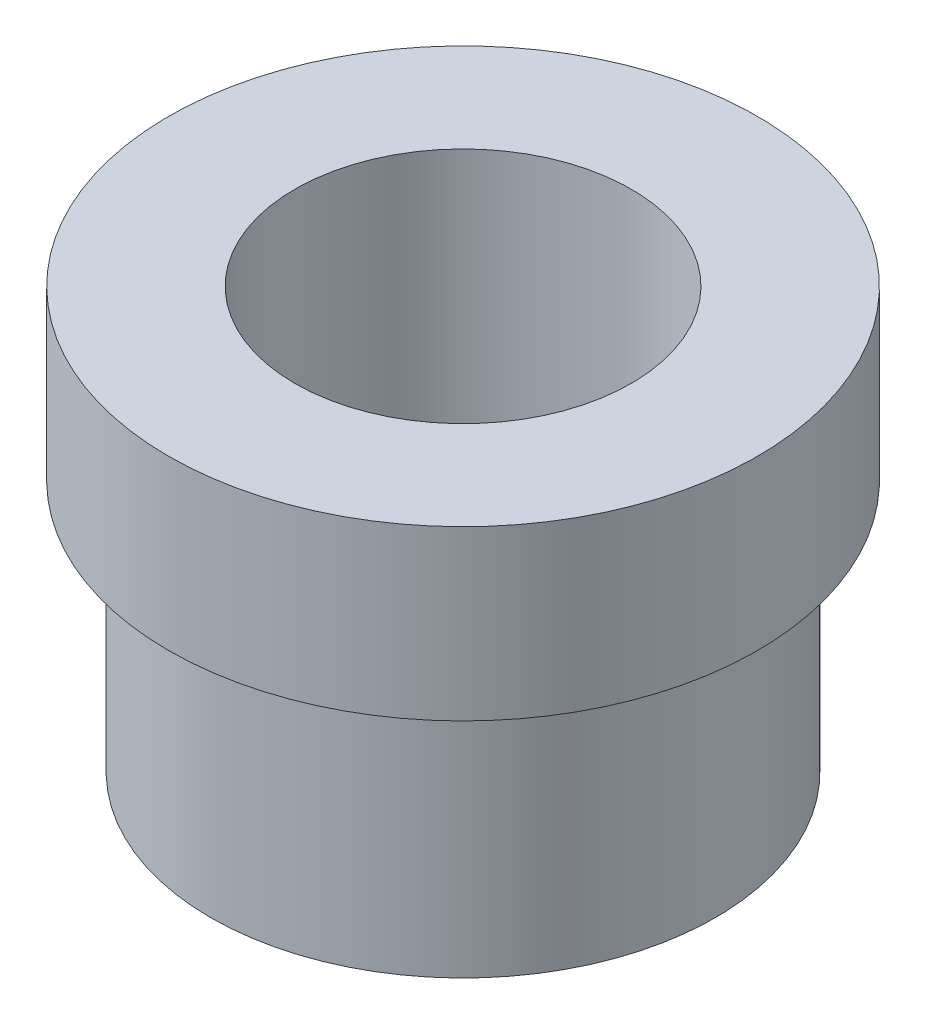
from build123d import *


with BuildPart() as part:
    # Sketch1 → Revolve1 (revolve)
    with BuildSketch(Plane.XY):
        Polygon((10, 0), (10, 25), (17.5, 25), (17.5, 15), (15, 15), (15, 0), align=None)
    revolve(axis=Axis((0, 61.834862385, 0), (0, -1, 0)))


solid = part.part
